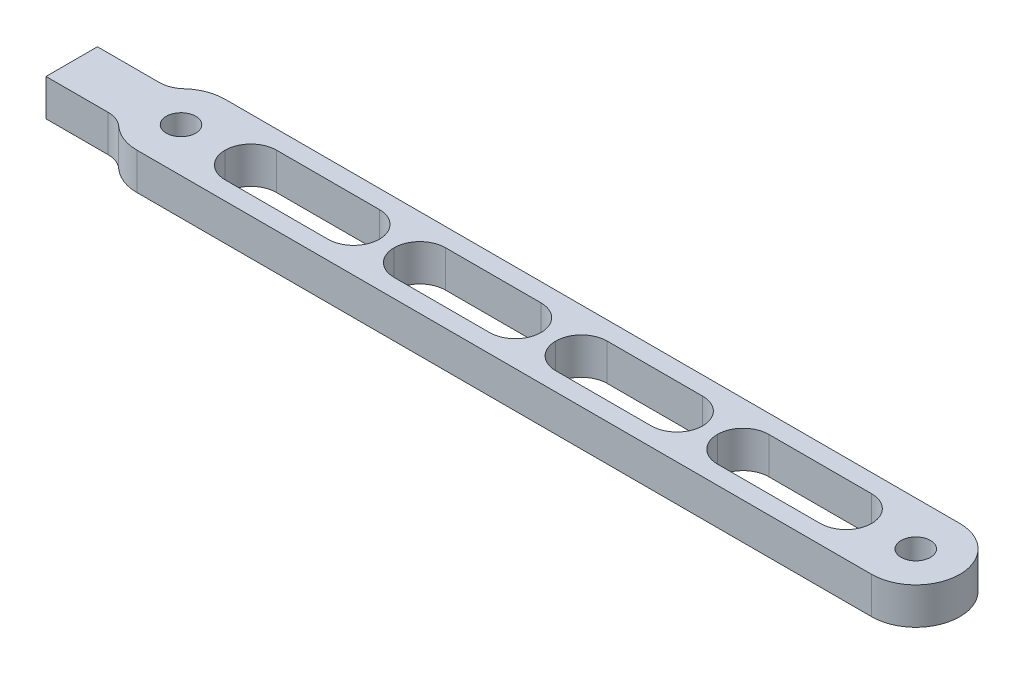
from build123d import *

# Parameters (mm, degrees)
SKETCH1_R           = 4
SKETCH1_W           = 42
SKETCH1_H           = 14
SKETCH1_W_2         = 40
BOSS_EXTRUDE1_DEPTH = 10
FILLET1_R           = 7


with BuildPart() as part:
    # Sketch1 → Boss-Extrude1 (new body)
    with BuildSketch(Plane(origin=(0, 0, 0), x_dir=(1, 0, 0), z_dir=(0, 1, 0))):
        with BuildLine():
            Line((-200, 12), (0, 12))
            ThreePointArc((0, 12), (12, 0), (0, -12))
            Line((0, -12), (-200, -12))
            ThreePointArc((-200, -12), (-205.477225575, -10.677078252), (-209.746794345, -7))
            Line((-209.746794345, -7), (-229.746794345, -7))
            Line((-229.746794345, -7), (-229.746794345, 7))
            Line((-229.746794345, 7), (-209.746794345, 7))
            ThreePointArc((-209.746794345, 7), (-205.477225575, 10.677078252), (-200, 12))
        make_face()
        with Locations(Location((-200, 0, 0), (0, 0, 270))):
            Circle(SKETCH1_R, mode=Mode.SUBTRACT)
        with Locations(Location((0, 0, 0), (0, 0, 270))):
            Circle(SKETCH1_R, mode=Mode.SUBTRACT)
        with Locations((-167, 0)):
            Rectangle(SKETCH1_W, SKETCH1_H, mode=Mode.SUBTRACT)
        with Locations((-122, 0)):
            Rectangle(SKETCH1_W_2, SKETCH1_H, mode=Mode.SUBTRACT)
        with Locations((-78, 0)):
            Rectangle(SKETCH1_W_2, SKETCH1_H, mode=Mode.SUBTRACT)
        with Locations((-33, 0)):
            Rectangle(SKETCH1_W, SKETCH1_H, mode=Mode.SUBTRACT)
    extrude(amount=BOSS_EXTRUDE1_DEPTH)

    # Fillet1
    fillet1_edges = [part.edges().sort_by_distance(p)[0] for p in [
        (-142, 5, -7),
        (-98, 5, -7),
        (-54, 5, -7),
        (-58, 5, -7),
        (-12, 5, -7),
        (-102, 5, -7),
        (-146, 5, -7),
        (-146, 5, 7),
        (-102, 5, 7),
        (-58, 5, 7),
        (-12, 5, 7),
        (-54, 5, 7),
        (-98, 5, 7),
        (-142, 5, 7),
        (-188, 5, 7),
        (-188, 5, -7),
        (-209.746794345, 5, 7),
        (-209.746794345, 5, -7),
    ]]
    fillet(fillet1_edges, radius=FILLET1_R - 0.0001)  # a hair under: the kernel refuses the full size


solid = part.part
